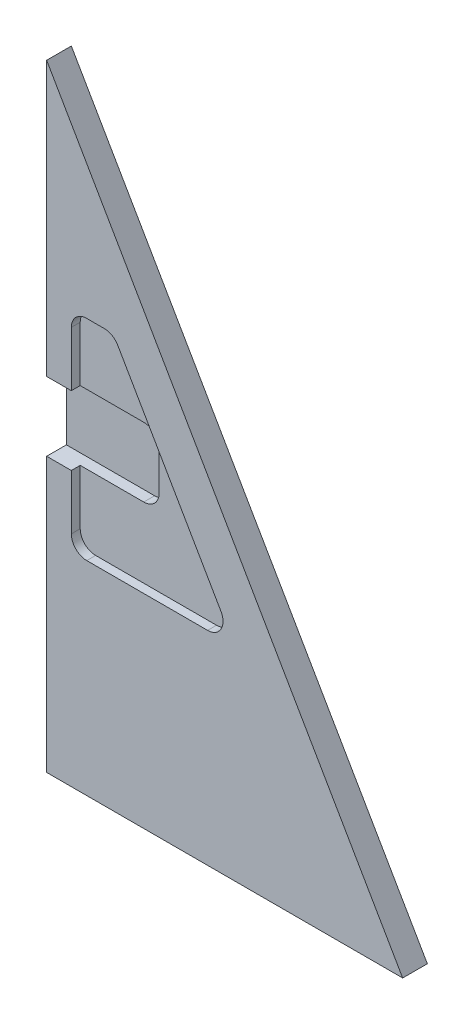
from build123d import *

# Parameters (mm, degrees)
EXTRUDE1_DEPTH = 2.54
EXTRUDE3_DEPTH = 2.032
EXTRUDE2_DEPTH = 0.9144
FILLET1_R      = 1.5875


with BuildPart() as part:
    # Sketch1 → Extrude1 (new body)
    with BuildSketch(Plane.XY):
        Polygon((0, 63.5), (36.6522, 0), (0, 0), align=None)
    extrude(amount=-EXTRUDE1_DEPTH)

    # Sketch4 → Extrude3 (cut)
    with BuildSketch(Plane.XY):
        Polygon((0, 31.75), (0, 35.306), (10.668, 35.306), (10.668, 28.194), (0, 28.194), align=None)
    extrude(amount=-EXTRUDE3_DEPTH, mode=Mode.SUBTRACT)

    # Sketch3 → Extrude2 (cut)
    with BuildSketch(Plane.XY):
        Polygon((2.54, 31.75), (2.54, 42.545), (6.858, 42.545), (19.319748, 20.955), (2.54, 20.955), align=None)
    extrude(amount=-EXTRUDE2_DEPTH, mode=Mode.SUBTRACT)

    # Fillet1
    fillet1_edges = [part.edges().sort_by_distance(p)[0] for p in [
        (2.54, 42.545, -0.4572),
        (10.668, 35.306, -1.4732),
        (10.668, 28.194, -1.4732),
        (6.858, 42.545, -0.4572),
        (19.319748, 20.955, -0.4572),
        (2.54, 20.955, -0.4572),
    ]]
    fillet(fillet1_edges, radius=FILLET1_R)


solid = part.part
